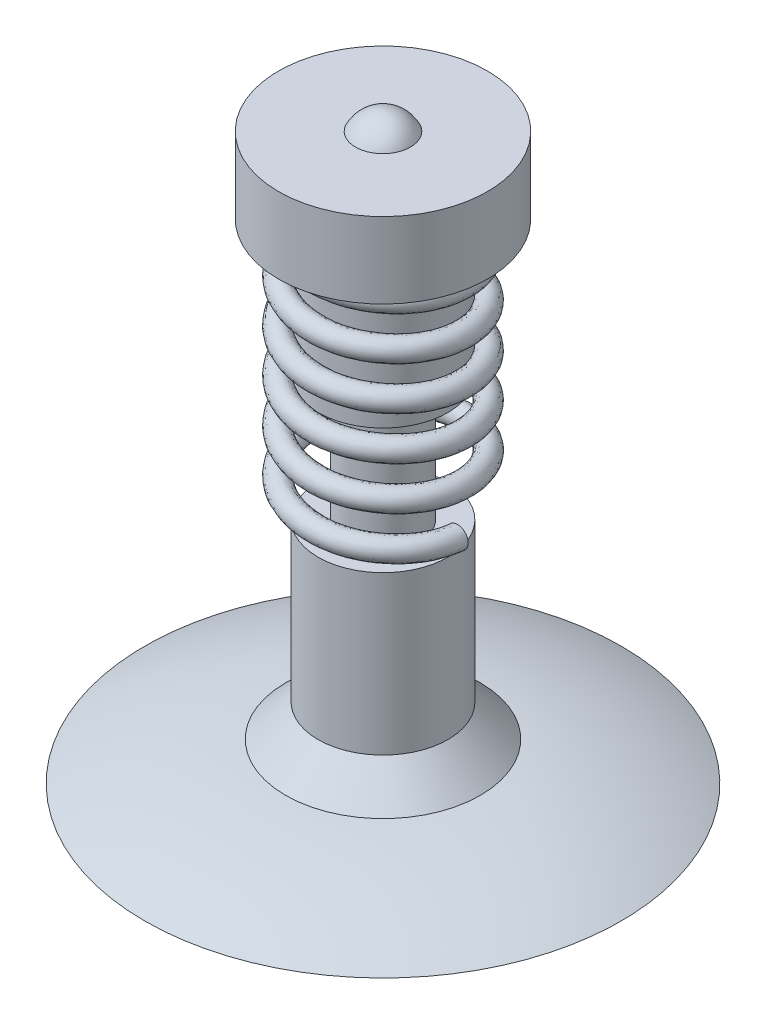
from build123d import *

# Parameters (mm, degrees)
SWEEP1_PITCH = 0.2


with BuildPart() as part:
    # Sketch2 → Revolve1 (revolve)
    with BuildSketch(Plane.XY, mode=Mode.PRIVATE) as revolve1_sk:
        with BuildLine():
            Line((0, 2.69), (0, 0))
            Line((0, 0), (1.1, 0))
            ThreePointArc((1.1, 0), (0.783253944, 0.119088317), (0.450002556, 0.17785568))
            Line((0.450002556, 0.17785568), (0.3, 0.325847832))
            Line((0.3, 0.325847832), (0.3, 1.055453223))
            Line((0.3, 1.055453223), (0.172, 1.055453223))
            Line((0.172, 1.055453223), (0.172, 1.547951305))
            Line((0.172, 1.547951305), (0.3, 1.633970924))
            Line((0.3, 1.633970924), (0.3, 2.258970924))
            Line((0.3, 2.258970924), (0.482563584, 2.258970924))
            Line((0.482563584, 2.258970924), (0.482563584, 2.608970924))
            Line((0.482563584, 2.608970924), (0.126814035, 2.608970924))
            ThreePointArc((0.126814035, 2.608970924), (0.074726944, 2.66720164), (0, 2.69))
        make_face()
    revolve(revolve1_sk.sketch.rotate(Axis((0, 2.69, 0), (0, -1, 0)), 90), axis=Axis((0, 2.69, 0), (0, -1, 0)))

    # Sweep1: arcs per turn and ends read off the stored shape
    # Sweep1: the profile of Sketch4 screwed along a left-hand helix through 5.5 turns, 6 arcs to a turn; built about Z, then put on its axis
    sweep1_z = Axis((0, 0, 0), (0, 0, 1))
    sweep1_corners = [(0.393508531, 0, 0), (0.344, 0, -0.049508531), (0.294491469, 0, 0), (0.344, 0, 0.049508531)]
    with BuildLine(mode=Mode.PRIVATE) as sweep1_profile:
        ThreePointArc((0.393508531, 0, 0), (0.379007818, 0, -0.035007818), (0.344, 0, -0.049508531))
        ThreePointArc((0.344, 0, -0.049508531), (0.308992182, 0, -0.035007818), (0.294491469, 0, 0))
        ThreePointArc((0.294491469, 0, 0), (0.308992182, 0, 0.035007818), (0.344, 0, 0.049508531))
        ThreePointArc((0.344, 0, 0.049508531), (0.379007818, 0, 0.035007818), (0.393508531, 0, 0))
    sweep1_cap = Face(sweep1_profile.wire())
    sweep1_arcs = [((0.393508531, 0, 0), (0.393508531, 0, -0.049508531), (0.344, 0, -0.049508531), (1, 0.7071067811865476, 1)), ((0.344, 0, -0.049508531), (0.294491469, 0, -0.049508531), (0.294491469, 0, 0), (1, 0.7071067811865476, 1)), ((0.294491469, 0, 0), (0.294491469, 0, 0.049508531), (0.344, 0, 0.049508531), (1, 0.7071067811865476, 1)), ((0.344, 0, 0.049508531), (0.393508531, 0, 0.049508531), (0.393508531, 0, 0), (1, 0.7071067811865476, 1))]  # start, shoulder, end, weights
    sweep1_turn_angles = [0, -30, -60, -90, -120, -150, -180, -210, -240, -270, -300, -330, -360]
    sweep1_turn_weights = [1, 0.8660254037844387, 1, 0.8660254037844387, 1, 0.8660254037844387, 1, 0.8660254037844387, 1, 0.8660254037844387, 1, 0.8660254037844387, 1]
    sweep1_turn_sides = [Face.make_bezier_surface([[Vector(p[j][0], p[j][1], 0).rotate(sweep1_z, sweep1_turn_angles[2 * i + k]) / sweep1_turn_weights[2 * i + k] + Vector(0, 0, p[j][2] + -SWEEP1_PITCH * sweep1_turn_angles[2 * i + k] / 360) for k in range(3)] for j in range(3)], [[p[3][j] * sweep1_turn_weights[2 * i + k] for k in range(3)] for j in range(3)]) for p in sweep1_arcs for i in range(6)]
    sweep1_last_angles = [-1800, -1830, -1860, -1890, -1920, -1950, -1980]
    sweep1_last_weights = [1, 0.8660254037844387, 1, 0.8660254037844387, 1, 0.8660254037844178, 1]
    sweep1_last_sides = [Face.make_bezier_surface([[Vector(p[j][0], p[j][1], 0).rotate(sweep1_z, sweep1_last_angles[2 * i + k]) / sweep1_last_weights[2 * i + k] + Vector(0, 0, p[j][2] + -SWEEP1_PITCH * sweep1_last_angles[2 * i + k] / 360) for k in range(3)] for j in range(3)], [[p[3][j] * sweep1_last_weights[2 * i + k] for k in range(3)] for j in range(3)]) for p in sweep1_arcs for i in range(3)]
    sweep1 = Plane(origin=(0, 2.258970924, 0), x_dir=(-1, 0, 0), z_dir=(0, -1, 0)) * Solid(Shell([*[p.moved(Location((0, 0, SWEEP1_PITCH * i))) for i in range(5) for p in sweep1_turn_sides], *sweep1_last_sides, sweep1_cap, sweep1_cap.rotate(sweep1_z, -1980).moved(Location((0, 0, -SWEEP1_PITCH * -1980 / 360)))]))
    add(sweep1)


solid = part.part
